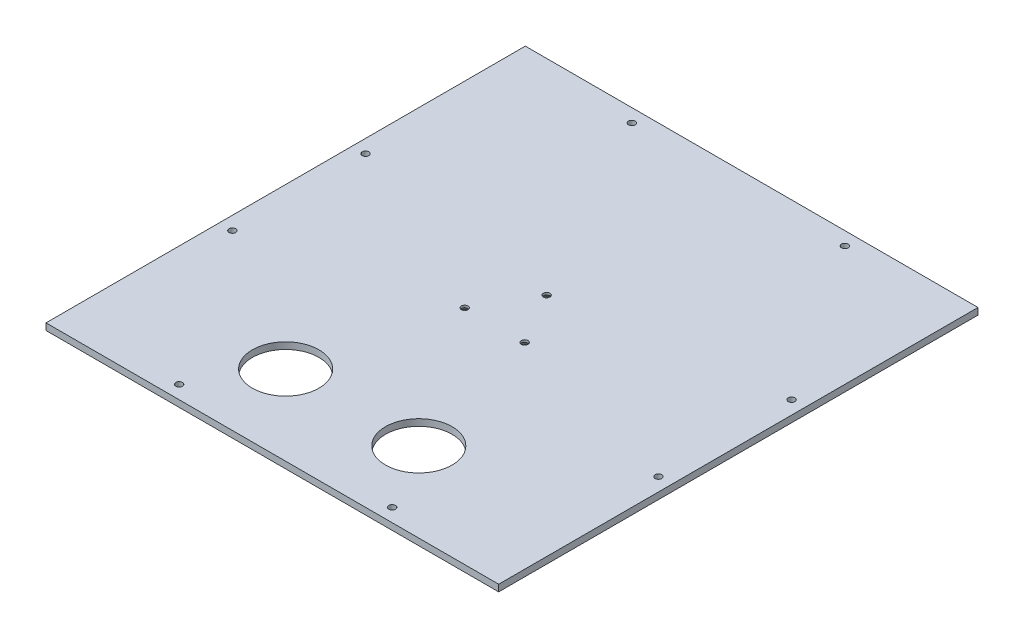
from build123d import *
from OCP.BRepFilletAPI import BRepFilletAPI_MakeChamfer

# Parameters (mm, degrees)
SKETCH1_W           = 215.9
SKETCH1_H           = 228.6
BOSS_EXTRUDE1_DEPTH = 3.175
SKETCH2_R           = 15.875
CUT_EXTRUDE1_DEPTH  = 315.453256661
SKETCH3_R           = 1.5875
CUT_EXTRUDE2_DEPTH  = 315.453256661
SKETCH4_R           = 1.5875
CUT_EXTRUDE3_DEPTH  = 315.453256661
CHAMFER1_SIZE       = 2.1082
CHAMFER1_SIZE2      = 1.832630301


with BuildPart() as part:
    # Sketch1 → Boss-Extrude1 (new body)
    with BuildSketch(Plane(origin=(0, 0, 0), x_dir=(1, 0, 0), z_dir=(0, 1, 0))):
        with Locations((107.95, 114.3)):
            Rectangle(SKETCH1_W, SKETCH1_H)
    extrude(amount=BOSS_EXTRUDE1_DEPTH)

    # Sketch2 → Cut-Extrude1 (cut, through all)
    with BuildSketch(Plane(origin=(0, 3.175, 0), x_dir=(1, 0, 0), z_dir=(0, 1, 0))):
        with Locations((139.7, 38.1)):
            Circle(SKETCH2_R)
        with Locations((76.2, 38.1)):
            Circle(SKETCH2_R)
    extrude(amount=-CUT_EXTRUDE1_DEPTH, mode=Mode.SUBTRACT)

    # Sketch3 → Cut-Extrude2 (cut, through all)
    with BuildSketch(Plane(origin=(0, 3.175, 0), x_dir=(1, 0, 0), z_dir=(0, 1, 0))):
        with Locations((107.95, 130.81)):
            Circle(SKETCH3_R)
        with Locations((122.248079416, 106.045)):
            Circle(SKETCH3_R)
        with Locations((93.651920584, 106.045)):
            Circle(SKETCH3_R)
    extrude(amount=-CUT_EXTRUDE2_DEPTH, mode=Mode.SUBTRACT)

    # Sketch4 → Cut-Extrude3 (cut, through all)
    with BuildSketch(Plane(origin=(0, 3.175, 0), x_dir=(1, 0, 0), z_dir=(0, 1, 0))):
        with Locations((6.35, 146.05)):
            Circle(SKETCH4_R)
        with Locations((6.35, 82.55)):
            Circle(SKETCH4_R)
        with Locations((57.15, 6.35)):
            Circle(SKETCH4_R)
        with Locations((57.15, 222.25)):
            Circle(SKETCH4_R)
        with Locations((158.75, 6.35)):
            Circle(SKETCH4_R)
        with Locations((209.55, 82.55)):
            Circle(SKETCH4_R)
        with Locations((209.55, 146.05)):
            Circle(SKETCH4_R)
        with Locations((158.75, 222.25)):
            Circle(SKETCH4_R)
    extrude(amount=-CUT_EXTRUDE3_DEPTH, mode=Mode.SUBTRACT)

    # Chamfer1: one chamfer whose edges measure the first distance from different faces: ONE call of the kernel's chamfer builder (chamfer() names one face for all edges)
    chamfer1_edges_1 = [part.edges().sort_by_distance(p)[0] for p in [
        (92.064420584, 0, -106.045),
    ]]
    chamfer1_side_1 = [part.faces().sort_by_distance(p)[0] for p in [
        (92.064420584, 1.5875, -106.045),
    ]]
    chamfer1_edges_2 = [part.edges().sort_by_distance(p)[0] for p in [
        (120.660579416, 0, -106.045),
    ]]
    chamfer1_side_2 = [part.faces().sort_by_distance(p)[0] for p in [
        (120.660579416, 1.5875, -106.045),
    ]]
    chamfer1_edges_3 = [part.edges().sort_by_distance(p)[0] for p in [
        (106.3625, 0, -130.81),
    ]]
    chamfer1_side_3 = [part.faces().sort_by_distance(p)[0] for p in [
        (106.3625, 1.5875, -130.81),
    ]]
    chamfer1 = BRepFilletAPI_MakeChamfer(part.part.solid().wrapped)
    for e in chamfer1_edges_1:
        chamfer1.Add(CHAMFER1_SIZE, CHAMFER1_SIZE2, e.wrapped, chamfer1_side_1[0].wrapped)  # the first distance lies on this face
    for e in chamfer1_edges_2:
        chamfer1.Add(CHAMFER1_SIZE, CHAMFER1_SIZE2, e.wrapped, chamfer1_side_2[0].wrapped)  # the first distance lies on this face
    for e in chamfer1_edges_3:
        chamfer1.Add(CHAMFER1_SIZE, CHAMFER1_SIZE2, e.wrapped, chamfer1_side_3[0].wrapped)  # the first distance lies on this face
    add(Compound.cast(chamfer1.Shape()), mode=Mode.REPLACE)


solid = part.part
